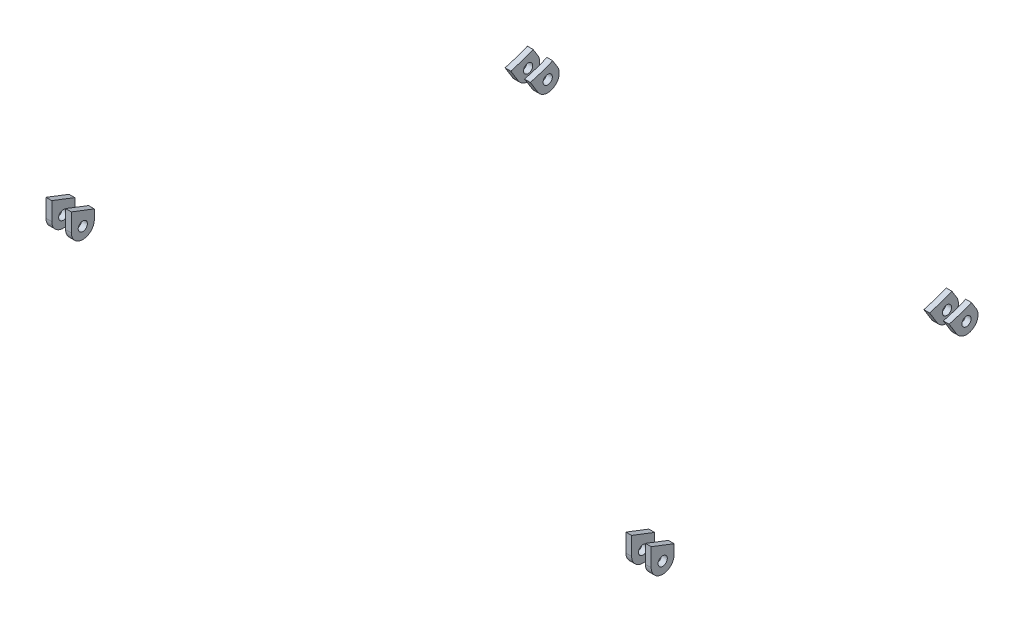
from build123d import *

# Parameters (mm, degrees)
BOSS_EXTRUDE1_DEPTH  = 10
BOSS_EXTRUDE2_DEPTH  = 1400
SPLIT2_DEPTH         = 10
SKETCH4_R            = 4
BOSS_EXTRUDE3_DEPTH  = 5
BOSS_EXTRUDE4_START  = -5
SKETCH5_R            = 4
BOSS_EXTRUDE4_DEPTH  = 5
BOSS_EXTRUDE5_START  = 5
SKETCH6_R            = 4
BOSS_EXTRUDE5_DEPTH  = 5
SKETCH7_R            = 4
BOSS_EXTRUDE6_DEPTH  = 5
SKETCH8_R            = 4
BOSS_EXTRUDE7_DEPTH  = 5
BOSS_EXTRUDE8_START  = -5
SKETCH9_R            = 4
BOSS_EXTRUDE8_DEPTH  = 5
SKETCH10_R           = 4
BOSS_EXTRUDE9_DEPTH  = 5
BOSS_EXTRUDE10_START = 5
SKETCH11_R           = 4
BOSS_EXTRUDE10_DEPTH = 5
SPLIT3_START         = 10
SPLIT3_DEPTH         = 1400


# Read off the part's stored shape, not the designer's step: Split2, Split3
with BuildPart() as part:
    # Sketch1 → Boss-Extrude1 (new body)
    with BuildSketch(Plane(origin=(0, 0, 0), x_dir=(0, 0, -1), z_dir=(1, 0, 0))):
        with BuildLine():
            Line((0, -39.159060238), (0, -399.159060238))
            ThreePointArc((0, -399.159060238), (2.810766389, -411.83760809), (10.716371709, -422.140393531))
            Line((10.716371709, -422.140393531), (202.227482489, -582.837295953))
            ThreePointArc((202.227482489, -582.837295953), (211.25050648, -588.046741283), (221.51111078, -589.855962659))
            Line((221.51111078, -589.855962659), (671.51111078, -589.855962659))
            ThreePointArc((671.51111078, -589.855962659), (692.724314215, -581.069166095), (701.51111078, -559.855962659))
            Line((701.51111078, -559.855962659), (701.51111078, -369.855962659))
            ThreePointArc((701.51111078, -369.855962659), (700.081380744, -360.705024227), (695.928465834, -352.426310564))
            Line((695.928465834, -352.426310564), (556.491249073, -157.087470131))
            ThreePointArc((556.491249073, -157.087470131), (549.188422732, -149.877866821), (539.883012979, -145.551320648))
            Line((539.883012979, -145.551320648), (37.809118961, -10.19325866))
            ThreePointArc((37.809118961, -10.19325866), (11.755460664, -15.344426409), (0, -39.159060238))
        make_face()
    extrude(amount=BOSS_EXTRUDE1_DEPTH)

    # Sketch2 → Boss-Extrude2 (add)
    with BuildSketch(Plane(origin=(10, 0, 0), x_dir=(0, 0, -1), z_dir=(1, 0, 0))):
        with BuildLine():
            ThreePointArc((626.364411935, -475.947865394), (654.270375926, -492.315038086), (646.133694128, -523.626722446))
            add(Edge.make_bspline(
                [(646.133694128, -523.626722446), (620.265200397, -544.090123727), (324.808789115, -589.015611509), (14.475713482, -342.918185901), (34.207392898, -327.560917886)],
                knots=[0, 0, 0, 0, 0.454280693, 1, 1, 1, 1], degree=3))
            ThreePointArc((34.207392898, -327.560917886), (38.301805286, -326.1553415), (42.396217675, -327.560917886))
            add(Edge.make_bspline(
                [(42.396217675, -327.560917886), (179.998241324, -434.657283692), (369.496171973, -510.067463814), (572.427382245, -482.279425386), (626.364411935, -475.947865394)],
                knots=[0, 0, 0, 0, 0.742688993, 1, 1, 1, 1], degree=3))
        make_face()
        with BuildLine():
            ThreePointArc((66.698936736, -215.359019498), (67.092959072, -208.260098077), (74.202765192, -208.284508838))
            add(Edge.make_bspline(
                [(74.202765192, -208.284508838), (81.149231878, -214.924232147), (316.076431581, -369.790908175), (526.742508558, -357.109499901), (567.085033992, -348.175125638)],
                knots=[0, 0, 0, 0, 0.768435057, 1, 1, 1, 1], degree=3))
            ThreePointArc((567.085033992, -348.175125638), (594.800287265, -365.58541059), (577.755509271, -393.526935767))
            add(Edge.make_bspline(
                [(66.698936736, -215.359019498), (100.320017518, -254.957400328), (300.322217315, -390.035120939), (509.639726303, -410.500517765), (577.755509271, -393.526935767)],
                knots=[0, 0, 0, 0, 0.654710405, 1, 1, 1, 1], degree=3))
        make_face()
        with BuildLine():
            ThreePointArc((92.163413905, -98.198220596), (93.433821546, -92.827514339), (98.829146805, -93.988930122))
            add(Edge.make_bspline(
                [(98.829146805, -93.988930122), (112.622758483, -114.88285895), (192.730208888, -182.13783781), (300.184384568, -194.688304583), (331.179728441, -194.685467652)],
                knots=[0, 0, 0, 0, 0.660882752, 1, 1, 1, 1], degree=3))
            ThreePointArc((331.179728441, -194.685467652), (341.545058852, -204.318697463), (332.693478174, -215.359019498))
            add(Edge.make_bspline(
                [(92.163413905, -98.198220596), (126.325036043, -154.802617957), (226.918714052, -224.562098265), (331.921739283, -215.472572374), (332.693478174, -215.359019498)],
                knots=[0, 0, 0, 0, 0.645739259, 1, 1, 1, 1], degree=3))
        make_face()
    extrude(amount=BOSS_EXTRUDE2_DEPTH)

    # Split2 outline → Split2 (cut)
    with BuildSketch(Plane.YZ):
        with BuildLine():
            ThreePointArc((-157.087470131, -556.491249073), (-149.877866821, -549.188422732), (-145.551320648, -539.883012979))
            Line((-145.551320648, -539.883012979), (-10.19325866, -37.809118961))
            ThreePointArc((-10.19325866, -37.809118961), (-15.344426409, -11.755460664), (-39.159060238, 0))
            Line((-39.159060238, 0), (-399.159060238, 0))
            ThreePointArc((-399.159060238, 0), (-411.83760809, -2.810766389), (-422.140393531, -10.716371709))
            Line((-422.140393531, -10.716371709), (-582.837295953, -202.227482489))
            ThreePointArc((-582.837295953, -202.227482489), (-588.046741283, -211.25050648), (-589.855962659, -221.51111078))
            Line((-589.855962659, -221.51111078), (-589.855962659, -671.51111078))
            ThreePointArc((-589.855962659, -671.51111078), (-581.069166095, -692.724314215), (-559.855962659, -701.51111078))
            Line((-559.855962659, -701.51111078), (-369.855962659, -701.51111078))
            ThreePointArc((-369.855962659, -701.51111078), (-360.705024227, -700.081380744), (-352.426310564, -695.928465834))
            Line((-352.426310564, -695.928465834), (-157.087470131, -556.491249073))
        make_face()
    extrude(amount=SPLIT2_DEPTH, mode=Mode.SUBTRACT)

    # Sketch4 → Boss-Extrude3 (add)
    with BuildSketch(Plane(origin=(968, 0, 0), x_dir=(0, 0, -1), z_dir=(1, 0, 0))):
        with BuildLine():
            Line((288.132678683, -503.125593865), (288.132678683, -519.545737388))
            ThreePointArc((288.132678683, -519.545737388), (298.132678683, -529.545737388), (308.132678683, -519.545737388))
            Line((308.132678683, -519.545737388), (308.132678683, -511.471886152))
            add(Edge.make_bspline(
                [(288.132678683, -503.125593865), (294.10320056, -505.512610704), (308.132678683, -511.471886152)],
                knots=[0, 0, 0, 1, 1, 1], degree=2))
        make_face()
        with Locations((298.132678683, -519.545737388)):
            Circle(SKETCH4_R, mode=Mode.SUBTRACT)
    extrude(amount=BOSS_EXTRUDE3_DEPTH)

    # Sketch5 → Boss-Extrude4 (add)
    with BuildSketch(Plane(origin=(956, 0, 0), x_dir=(0, 0, -1), z_dir=(1, 0, 0)).offset(BOSS_EXTRUDE4_START)):
        with BuildLine():
            Line((288.132678683, -503.125593865), (288.132678683, -519.545737388))
            ThreePointArc((288.132678683, -519.545737388), (298.132678683, -529.545737388), (308.132678683, -519.545737388))
            Line((308.132678683, -519.545737388), (308.132678683, -511.471886152))
            add(Edge.make_bspline(
                [(308.132678683, -511.471886152), (294.103200562, -505.512610705), (288.132678683, -503.125593865)],
                knots=[0, 0, 0, 1, 1, 1], degree=2))
        make_face()
        with Locations((298.132678683, -519.545737388)):
            Circle(SKETCH5_R, mode=Mode.SUBTRACT)
    extrude(amount=BOSS_EXTRUDE4_DEPTH)

    # Sketch6 → Boss-Extrude5 (add)
    with BuildSketch(Plane.ZY.offset(-452).offset(BOSS_EXTRUDE5_START)):
        with BuildLine():
            Line((-288.132678683, -519.545737388), (-288.132678683, -503.125593865))
            add(Edge.make_bspline(
                [(-288.132678683, -503.125593865), (-294.103200562, -505.512610705), (-308.132678683, -511.471886152)],
                knots=[0, 0, 0, 1, 1, 1], degree=2))
            Line((-308.132678683, -511.471886152), (-308.132678683, -519.545737388))
            ThreePointArc((-308.132678683, -519.545737388), (-298.132678683, -529.545737388), (-288.132678683, -519.545737388))
        make_face()
        with Locations(Location((-298.132678683, -519.545737388, 0), (0, 0, 180))):
            Circle(SKETCH6_R, mode=Mode.SUBTRACT)
    extrude(amount=-BOSS_EXTRUDE5_DEPTH)

    # Sketch7 → Boss-Extrude6 (add)
    with BuildSketch(Plane.ZY.offset(-464)):
        with BuildLine():
            Line((-288.132678683, -519.545737388), (-288.132678683, -503.125593865))
            add(Edge.make_bspline(
                [(-288.132678683, -503.125593865), (-294.103200562, -505.512610705), (-308.132678683, -511.471886152)],
                knots=[0, 0, 0, 1, 1, 1], degree=2))
            Line((-308.132678683, -511.471886152), (-308.132678683, -519.545737388))
            ThreePointArc((-308.132678683, -519.545737388), (-298.132678683, -529.545737388), (-288.132678683, -519.545737388))
        make_face()
        with Locations(Location((-298.132678683, -519.545737388, 0), (0, 0, 180))):
            Circle(SKETCH7_R, mode=Mode.SUBTRACT)
    extrude(amount=-BOSS_EXTRUDE6_DEPTH)

    # Sketch8 → Boss-Extrude7 (add)
    with BuildSketch(Plane(origin=(898, 0, 0), x_dir=(0, 0, -1), z_dir=(1, 0, 0))):
        with BuildLine():
            Line((617.1189132, -535.783369671), (623.687203666, -546.432337306))
            ThreePointArc((623.687203666, -546.432337306), (637.584554422, -549.608142918), (640.536054647, -535.661431988))
            Line((640.536054647, -535.661431988), (636.514752084, -529.141817628))
            Line((636.514752084, -529.141817628), (617.1189132, -535.783369671))
        make_face()
        with Locations((632.198402735, -541.182623942)):
            Circle(SKETCH8_R, mode=Mode.SUBTRACT)
    extrude(amount=BOSS_EXTRUDE7_DEPTH)

    # Sketch9 → Boss-Extrude8 (add)
    with BuildSketch(Plane(origin=(886, 0, 0), x_dir=(0, 0, -1), z_dir=(1, 0, 0)).offset(BOSS_EXTRUDE8_START)):
        with BuildLine():
            Line((617.1189132, -535.783369671), (623.687203666, -546.432337306))
            ThreePointArc((623.687203666, -546.432337306), (637.584554422, -549.608142918), (640.536054647, -535.661431988))
            Line((640.536054647, -535.661431988), (636.514752084, -529.141817628))
            Line((636.514752084, -529.141817628), (617.1189132, -535.783369671))
        make_face()
        with Locations((632.198402735, -541.182623942)):
            Circle(SKETCH9_R, mode=Mode.SUBTRACT)
    extrude(amount=BOSS_EXTRUDE8_DEPTH)

    # Sketch10 → Boss-Extrude9 (add)
    with BuildSketch(Plane.ZY.offset(-534)):
        with BuildLine():
            Line((-623.687203666, -546.432337306), (-617.1189132, -535.783369671))
            Line((-617.1189132, -535.783369671), (-636.514752084, -529.141817628))
            Line((-636.514752084, -529.141817628), (-640.536054647, -535.661431988))
            ThreePointArc((-640.536054647, -535.661431988), (-637.584554422, -549.608142918), (-623.687203666, -546.432337306))
        make_face()
        with Locations(Location((-632.198402735, -541.182623942, 0), (0, 0, 180))):
            Circle(SKETCH10_R, mode=Mode.SUBTRACT)
    extrude(amount=-BOSS_EXTRUDE9_DEPTH)

    # Sketch11 → Boss-Extrude10 (add)
    with BuildSketch(Plane.ZY.offset(-522).offset(BOSS_EXTRUDE10_START)):
        with BuildLine():
            Line((-623.687203666, -546.432337306), (-617.1189132, -535.783369671))
            Line((-617.1189132, -535.783369671), (-636.514752084, -529.141817628))
            Line((-636.514752084, -529.141817628), (-640.536054647, -535.661431988))
            ThreePointArc((-640.536054647, -535.661431988), (-637.584554422, -549.608142918), (-623.687203666, -546.432337306))
        make_face()
        with Locations(Location((-632.198402735, -541.182623942, 0), (0, 0, 180))):
            Circle(SKETCH11_R, mode=Mode.SUBTRACT)
    extrude(amount=-BOSS_EXTRUDE10_DEPTH)

    # Split3 outline → Split3 (cut)
    with BuildSketch(Plane.YZ.offset(SPLIT3_START)):
        with BuildLine():
            add(Edge.make_bspline(
                [(-511.471886152, -308.132678683), (-516.43969624, -321.631784584), (-557.088541152, -444.350129763), (-549.96236653, -564.626286038), (-535.783369672, -617.1189132)],
                knots=[0.500894987, 0.500894987, 0.500894987, 0.500894987, 0.545719307, 0.906064579, 0.906064579, 0.906064579, 0.906064579], degree=3))
            add(Edge.make_bspline(
                [(-535.783369672, -617.1189132), (-533.706392576, -624.808172558), (-531.461165575, -631.328504266), (-529.14181754, -636.51475228)],
                knots=[0.906064579, 0.906064579, 0.906064579, 0.906064579, 0.958848911, 0.958848911, 0.958848911, 0.958848911], degree=3))
            add(Edge.make_bspline(
                [(-529.14181754, -636.51475228), (-527.333635229, -640.557992803), (-525.480402933, -643.790392475), (-523.626722446, -646.133694128)],
                knots=[0.958848911, 0.958848911, 0.958848911, 0.958848911, 1, 1, 1, 1], degree=3))
            ThreePointArc((-523.626722446, -646.133694128), (-492.315038086, -654.270375926), (-475.947865394, -626.364411935))
            add(Edge.make_bspline(
                [(-475.947865394, -626.364411935), (-482.279425386, -572.427382245), (-510.067463814, -369.496171973), (-434.657283692, -179.998241324), (-327.560917886, -42.396217675)],
                knots=[0, 0, 0, 0, 0.257311007, 1, 1, 1, 1], degree=3))
            ThreePointArc((-327.560917886, -42.396217675), (-326.1553415, -38.301805286), (-327.560917886, -34.207392898))
            add(Edge.make_bspline(
                [(-327.560917886, -34.207392898), (-341.031625272, -16.899647836), (-446.017106891, -145.075235312), (-503.752882851, -288.132678683)],
                knots=[0, 0, 0, 0, 0.478680524, 0.478680524, 0.478680524, 0.478680524], degree=3))
            add(Edge.make_bspline(
                [(-503.752882851, -288.132678683), (-506.432267483, -294.771645752), (-509.009891619, -301.442663498), (-511.471886152, -308.132678683)],
                knots=[0.478680524, 0.478680524, 0.478680524, 0.478680524, 0.500894987, 0.500894987, 0.500894987, 0.500894987], degree=3))
        make_face()
        with BuildLine():
            ThreePointArc((-93.988930122, -98.829146805), (-92.827514339, -93.433821546), (-98.198220596, -92.163413905))
            add(Edge.make_bspline(
                [(-98.198220596, -92.163413905), (-154.802617957, -126.325036043), (-224.562098265, -226.918714052), (-215.472572374, -331.921739283), (-215.359019498, -332.693478174)],
                knots=[0, 0, 0, 0, 0.645739259, 1, 1, 1, 1], degree=3))
            ThreePointArc((-215.359019498, -332.693478174), (-204.318697463, -341.545058852), (-194.685467652, -331.179728441))
            add(Edge.make_bspline(
                [(-194.685467652, -331.179728441), (-194.688304583, -300.184384568), (-182.13783781, -192.730208888), (-114.88285895, -112.622758483), (-93.988930122, -98.829146805)],
                knots=[0, 0, 0, 0, 0.339117248, 1, 1, 1, 1], degree=3))
        make_face()
        with BuildLine():
            ThreePointArc((-208.284508838, -74.202765192), (-208.260098077, -67.092959072), (-215.359019498, -66.698936736))
            add(Edge.make_bspline(
                [(-215.359019498, -66.698936736), (-254.957400328, -100.320017518), (-390.035120939, -300.322217315), (-410.500517765, -509.639726303), (-393.526935767, -577.755509271)],
                knots=[0, 0, 0, 0, 0.654710405, 1, 1, 1, 1], degree=3))
            ThreePointArc((-393.526935767, -577.755509271), (-365.58541059, -594.800287265), (-348.175125638, -567.085033992))
            add(Edge.make_bspline(
                [(-348.175125638, -567.085033992), (-357.109499901, -526.742508558), (-369.790908175, -316.076431581), (-214.924232147, -81.149231878), (-208.284508838, -74.202765192)],
                knots=[0, 0, 0, 0, 0.231564943, 1, 1, 1, 1], degree=3))
        make_face()
    extrude(amount=SPLIT3_DEPTH, mode=Mode.SUBTRACT)


solid = part.part
